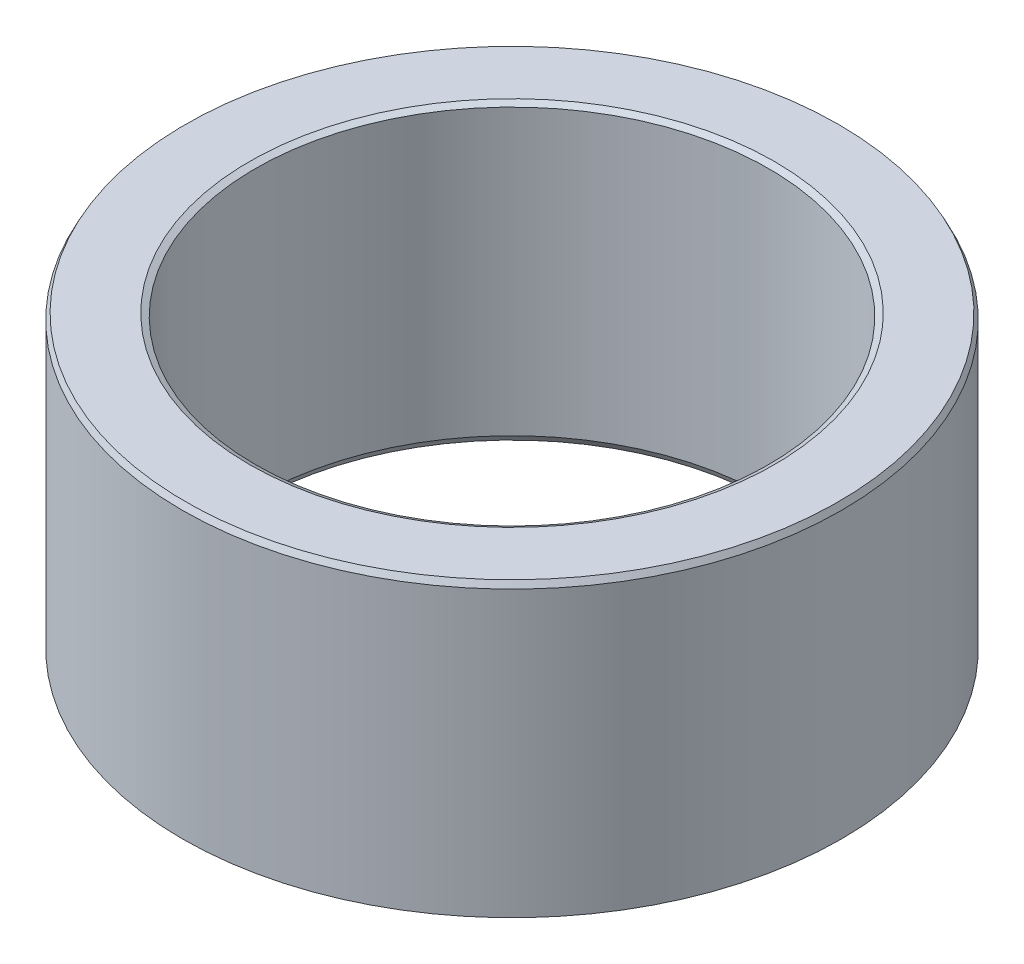
from build123d import *
from OCP.BRepFilletAPI import BRepFilletAPI_MakeChamfer

# Parameters (mm, degrees)
SKETCH1_R           = 30
BOSS_EXTRUDE1_DEPTH = 26.715615937
SKETCH2_R           = 23.343969072
CUT_EXTRUDE1_DEPTH  = 51.137053512
CHAMFER1_SIZE       = 0.543514867
CHAMFER1_SIZE2      = 0.277808058


with BuildPart() as part:
    # Sketch1 → Boss-Extrude1 (new body)
    with BuildSketch(Plane(origin=(0, 0, 0), x_dir=(1, 0, 0), z_dir=(0, 1, 0))):
        Circle(SKETCH1_R)
    extrude(amount=BOSS_EXTRUDE1_DEPTH)

    # Sketch2 → Cut-Extrude1 (cut, through all)
    with BuildSketch(Plane(origin=(0, 0, 0), x_dir=(1, 0, 0), z_dir=(0, 1, 0))):
        Circle(SKETCH2_R)
    extrude(amount=CUT_EXTRUDE1_DEPTH, mode=Mode.SUBTRACT)

    # Chamfer1: one chamfer whose edges measure the first distance from different faces: ONE call of the kernel's chamfer builder (chamfer() names one face for all edges)
    chamfer1_edges_1 = [part.edges().sort_by_distance(p)[0] for p in [
        (-23.343969072, 26.715615937, 0),
    ]]
    chamfer1_side_1 = [part.faces().sort_by_distance(p)[0] for p in [
        (-29.151471863, 26.715615937, 0),
    ]]
    chamfer1_edges_2 = [part.edges().sort_by_distance(p)[0] for p in [
        (-23.343969072, 0, 0),
    ]]
    chamfer1_side_2 = [part.faces().sort_by_distance(p)[0] for p in [
        (-23.343969072, 13.357807969, 0),
    ]]
    chamfer1_edges_3 = [part.edges().sort_by_distance(p)[0] for p in [
        (-30, 0, 0),
    ]]
    chamfer1_side_3 = [part.faces().sort_by_distance(p)[0] for p in [
        (-29.151471863, 0, 0),
    ]]
    chamfer1_edges_4 = [part.edges().sort_by_distance(p)[0] for p in [
        (-30, 26.715615937, 0),
    ]]
    chamfer1_side_4 = [part.faces().sort_by_distance(p)[0] for p in [
        (-30, 13.357807969, 0),
    ]]
    chamfer1 = BRepFilletAPI_MakeChamfer(part.part.solid().wrapped)
    for e in chamfer1_edges_1:
        chamfer1.Add(CHAMFER1_SIZE, CHAMFER1_SIZE2, e.wrapped, chamfer1_side_1[0].wrapped)  # the first distance lies on this face
    for e in chamfer1_edges_2:
        chamfer1.Add(CHAMFER1_SIZE, CHAMFER1_SIZE2, e.wrapped, chamfer1_side_2[0].wrapped)  # the first distance lies on this face
    for e in chamfer1_edges_3:
        chamfer1.Add(CHAMFER1_SIZE, CHAMFER1_SIZE2, e.wrapped, chamfer1_side_3[0].wrapped)  # the first distance lies on this face
    for e in chamfer1_edges_4:
        chamfer1.Add(CHAMFER1_SIZE, CHAMFER1_SIZE2, e.wrapped, chamfer1_side_4[0].wrapped)  # the first distance lies on this face
    add(Compound.cast(chamfer1.Shape()), mode=Mode.REPLACE)


solid = part.part
